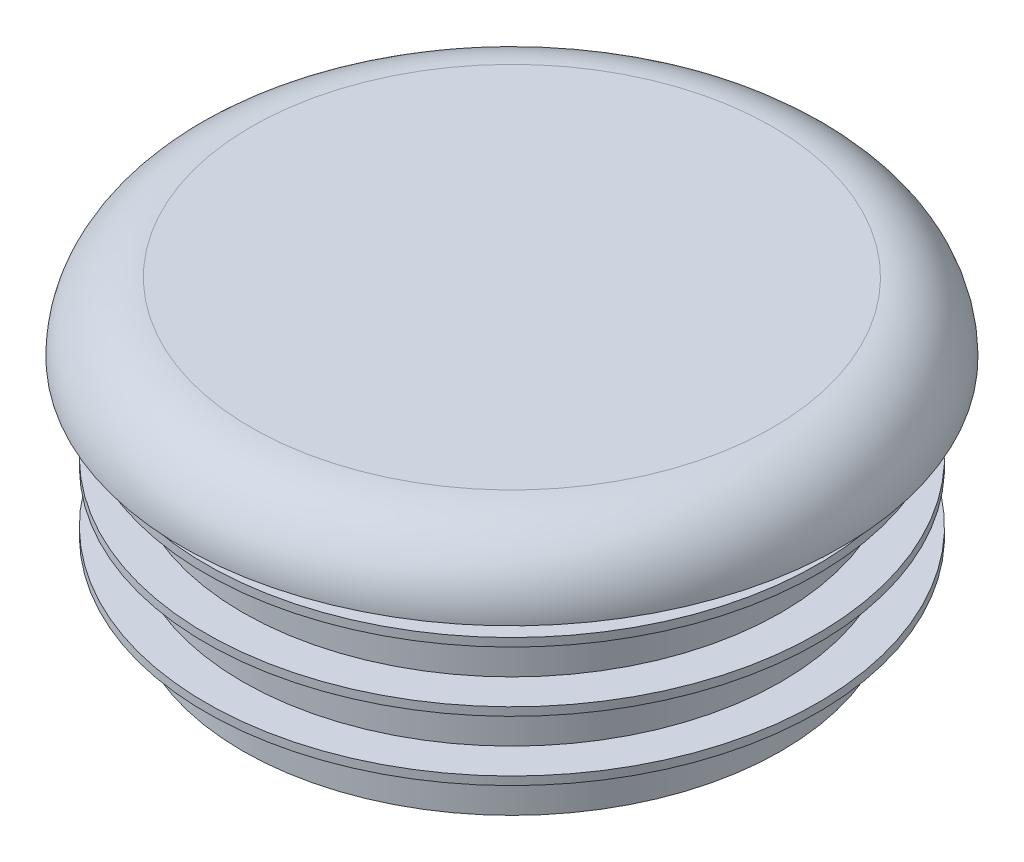
from build123d import *

# Parameters (mm, degrees)
BOSS_EXTRUDE1_START = -8.805333
SKETCH5_R           = 17.197916667
BOSS_EXTRUDE1_DEPTH = 13.208
SKETCH6_R           = 16.09725
CUT_EXTRUDE1_DEPTH  = 14.675555556


# Read off the part's stored shape, not the designer's step: LPattern1
with BuildPart() as part:
    # Sketch4 → Revolve2 (revolve)
    with BuildSketch(Plane.XY, mode=Mode.PRIVATE) as revolve2_sk:
        with BuildLine():
            Line((0, 8.805333333), (0, 4.402666667))
            Line((0, 4.402666667), (21.05025, 4.402666667))
            ThreePointArc((21.05025, 4.402666667), (19.760738789, 7.515822122), (16.647583333, 8.805333333))
            Line((16.647583333, 8.805333333), (0, 8.805333333))
        make_face()
        Polygon((0, 2.685626667), (19.536840212, 2.685626667), (19.536840212, 2.157306667), (17.197916667, 0.572346667), (0, 0.572346667), align=None)
    revolve(revolve2_sk.sketch.rotate(Axis((0, -8.805333333, 0), (0, 1, 0)), 90), axis=Axis((0, -8.805333333, 0), (0, 1, 0)))



with BuildPart() as body_2:
    # LPattern1 outline → LPattern1 (revolve)
    with BuildSketch(Plane.XY):
        Polygon((19.536840212, -5.503333333), (19.536840212, -4.975013333), (0, -4.975013333), (0, -7.088293333), (17.197916667, -7.088293333), align=None)
        Polygon((0, -1.144693333), (0, -3.257973333), (17.197916667, -3.257973333), (19.536840213, -1.673013333), (19.536840212, -1.144693333), align=None)
    revolve(axis=Axis((0, 0, 0), (0, 1, 0)))


with BuildPart() as part_1:
    add(part.part)

    add(body_2.part)  # Boss-Extrude1 merges body 2
    # Sketch5 → Boss-Extrude1 (add)
    with BuildSketch(Plane(origin=(0, 0, 0), x_dir=(1, 0, 0), z_dir=(0, 1, 0)).offset(BOSS_EXTRUDE1_START)):
        with Locations(Location((0, 0, 0), (0, 0, 90))):
            Circle(SKETCH5_R)
    extrude(amount=BOSS_EXTRUDE1_DEPTH)

    # Sketch6 → Cut-Extrude1 (cut)
    with BuildSketch(Plane.XZ.offset(8.805333333)):
        with Locations(Location((0, 0, 0), (0, 0, 270))):
            Circle(SKETCH6_R)
    extrude(amount=-CUT_EXTRUDE1_DEPTH, mode=Mode.SUBTRACT)


solid = part_1.part
